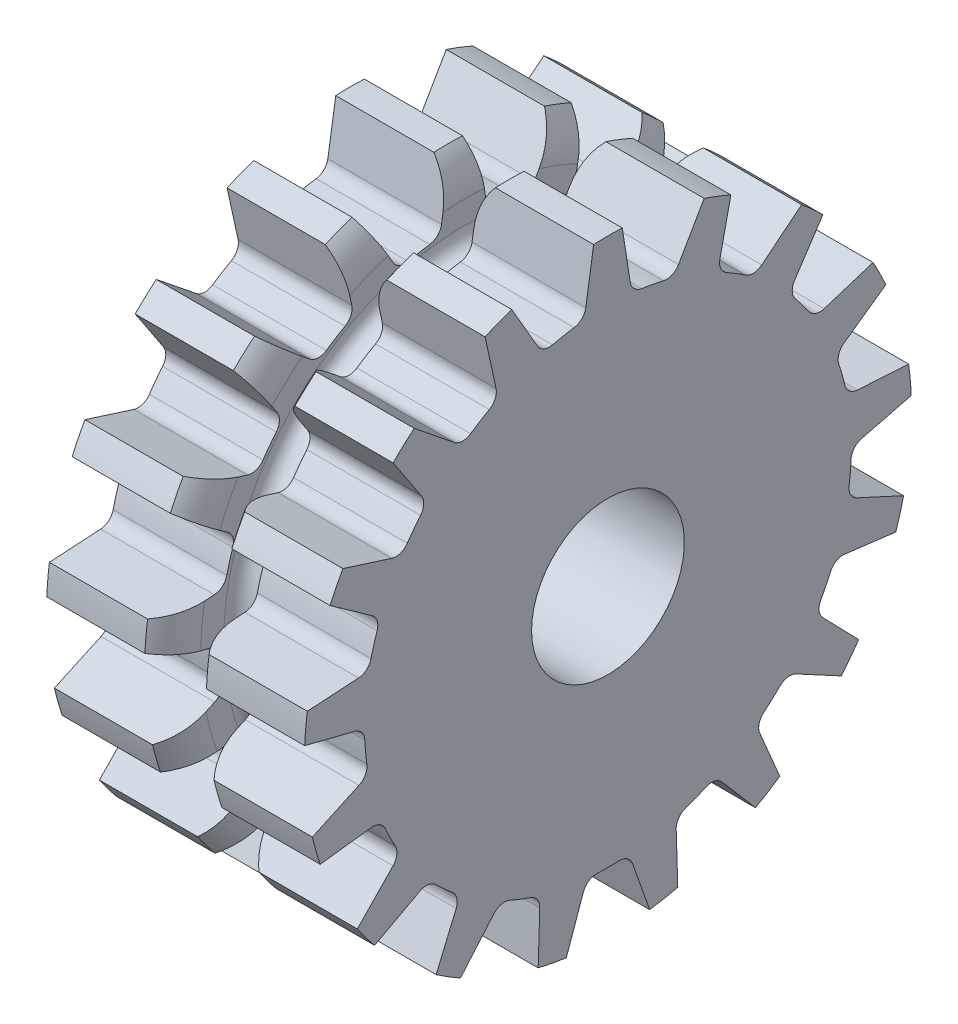
from build123d import *

# Parameters (mm, degrees)
BASPROSKE_W           = 21.4376
BASPROSKE_H           = 25.231725
TOOTHCUTSQUARE_DEPTH  = 42.627521986
TEETHCUTSSQUARE_COUNT = 17
TEETHCUTSSQUARE_ANGLE = 338.823529412
BORSKE_R              = 6.35
BORE_DEPTH            = 76.2000508


with BuildPart() as part:
    # BasProSke → Body (revolve)
    with BuildSketch(Plane(origin=(0, 0, 0), x_dir=(1, 0, 0), z_dir=(0, 1, 0))):
        with Locations((10.7188, 12.6158625)):
            Rectangle(BASPROSKE_W, BASPROSKE_H)
    revolve(axis=Axis((-10, 0, 0), (1, 0, 0)))

    # TooCutSqSke → ToothCutSquare (cut, through all)
    with BuildSketch(Plane(origin=(0, 0, 0), x_dir=(0, 0, -1), z_dir=(1, 0, 0))):
        with BuildLine():
            Line((-5.862352268, 20.238374774), (-8.31855065, 24.492635165))
            ThreePointArc((-8.31855065, 24.492635165), (-4.752998246, 25.426294852), (-1.090942866, 25.843709213))
            Line((-1.090942866, 25.843709213), (-1.844463535, 20.989448346))
            ThreePointArc((-1.844463535, 20.989448346), (-2.171553765, 20.350753709), (-2.814892153, 20.032894342))
            ThreePointArc((-2.814892153, 20.032894342), (-3.71719631, 19.885243904), (-4.611907369, 19.69697398))
            ThreePointArc((-4.611907369, 19.69697398), (-5.326626597, 19.760968381), (-5.862352268, 20.238374774))
        make_face()
    toothcutsquare = extrude(amount=TOOTHCUTSQUARE_DEPTH, mode=Mode.SUBTRACT)

    # TeethCutsSquare: ToothCutSquare ×17 about axis
    teethcutssquare_axis = Axis((-10, 0, 0), (1, 0, 0))
    for i in range(1, TEETHCUTSSQUARE_COUNT):
        add(toothcutsquare.rotate(teethcutssquare_axis, i * TEETHCUTSSQUARE_ANGLE / (TEETHCUTSSQUARE_COUNT - 1)), mode=Mode.SUBTRACT)

    # GrvSke → Groove (revolve, cut)
    with BuildSketch(Plane(origin=(0, 0, 0), x_dir=(1, 0, 0), z_dir=(0, 1, 0))):
        with BuildLine():
            Line((11.98626, 21.853525), (11.98626, 19.9501125))
            ThreePointArc((11.98626, 19.9501125), (10.71626, 18.6801125), (9.44626, 19.9501125))
            Line((9.44626, 19.9501125), (9.44626, 21.853525))
            ThreePointArc((9.44626, 21.853525), (8.621732426, 24.627935645), (6.415805501, 26.501725))
            Line((6.415805501, 26.501725), (15.016714499, 26.501725))
            ThreePointArc((15.016714499, 26.501725), (12.810787574, 24.627935645), (11.98626, 21.853525))
        make_face()
    revolve(axis=Axis((-14.834179634, 0, 0), (1, 0, 0)), mode=Mode.SUBTRACT)

    # BorSke → Bore (cut, symmetric)
    with BuildSketch(Plane(origin=(0, 0, 0), x_dir=(0, 0, -1), z_dir=(1, 0, 0))):
        Circle(BORSKE_R)
    extrude(amount=BORE_DEPTH, both=True, mode=Mode.SUBTRACT)


solid = part.part
